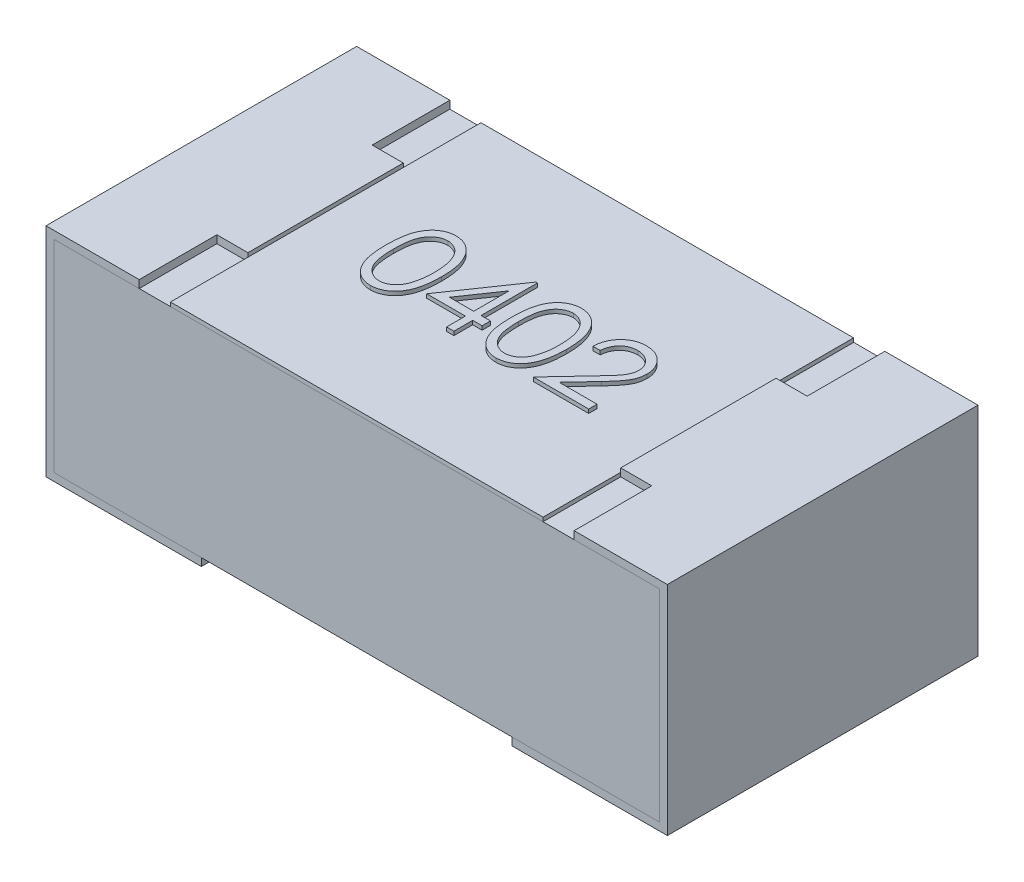
from build123d import *

# Parameters (mm, degrees)
CROQUIS1_W              = 1
CROQUIS1_H              = 0.5
SALIENTE_EXTRUIR1_DEPTH = 0.35
CROQUIS2_W              = 0.5
CROQUIS2_H              = 0.0125
CROQUIS2_W_2            = 0.6
CORTAR_EXTRUIR1_DEPTH   = 1.788986692
CROQUIS3_W              = 0.05
CROQUIS3_H              = 0.125
CORTAR_EXTRUIR3_DEPTH   = 0.0125
CROQUIS4_W              = 0.6
CROQUIS4_H              = 0.5
SALIENTE_EXTRUIR2_DEPTH = 0.00625
SALIENTE_EXTRUIR2_TAPER = 1
SALIENTE_EXTRUIR3_START = 0.34375
SALIENTE_EXTRUIR3_DEPTH = 0.00625


# Read off the part's stored shape, not the designer's step: Saliente-Extruir3
with BuildPart() as part:
    # Croquis1 → Saliente-Extruir1 (new body)
    with BuildSketch(Plane(origin=(0, 0, 0), x_dir=(1, 0, 0), z_dir=(0, 1, 0))):
        Rectangle(CROQUIS1_W, CROQUIS1_H)
    extrude(amount=SALIENTE_EXTRUIR1_DEPTH)

    # Croquis2 → Cortar-Extruir1 (cut, through all)
    with BuildSketch(Plane.XY.offset(0.25)):
        with Locations((0, 0.00625)):
            Rectangle(CROQUIS2_W, CROQUIS2_H)
        with Locations((0, 0.34375)):
            Rectangle(CROQUIS2_W_2, CROQUIS2_H)
    extrude(amount=-CORTAR_EXTRUIR1_DEPTH, mode=Mode.SUBTRACT)

    # Croquis3 → Cortar-Extruir3 (cut)
    with BuildSketch(Plane(origin=(0, 0.35, 0), x_dir=(1, 0, 0), z_dir=(0, 1, 0))):
        with Locations((-0.325, -0.1875)):
            Rectangle(CROQUIS3_W, CROQUIS3_H)
        with Locations((-0.325, 0.1875)):
            Rectangle(CROQUIS3_W, CROQUIS3_H)
        with Locations((0.325, 0.1875)):
            Rectangle(CROQUIS3_W, CROQUIS3_H)
        with Locations((0.325, -0.1875)):
            Rectangle(CROQUIS3_W, CROQUIS3_H)
    extrude(amount=-CORTAR_EXTRUIR3_DEPTH, mode=Mode.SUBTRACT)

    # Croquis4 → Saliente-Extruir2 (add)
    with BuildSketch(Plane(origin=(0, 0.3375, 0), x_dir=(1, 0, 0), z_dir=(0, 1, 0))):
        Rectangle(CROQUIS4_W, CROQUIS4_H)
    extrude(amount=SALIENTE_EXTRUIR2_DEPTH, taper=SALIENTE_EXTRUIR2_TAPER)

    # Saliente-Extruir3 outline → Saliente-Extruir3 (add)
    # profile 1 of 4: a face of its own
    with BuildSketch(Plane(origin=(0, 0, 0), x_dir=(1, 0, 0), z_dir=(0, 1, 0)).offset(SALIENTE_EXTRUIR3_START)):
        with BuildLine():
            add(Edge.make_bspline(
                [(-0.155899178, -0.072053334), (-0.156933758, -0.072035856), (-0.158973746, -0.072001391), (-0.161996532, -0.071644825), (-0.164930494, -0.071071562), (-0.167790108, -0.070268885), (-0.170590046, -0.069286375), (-0.173292155, -0.068006323), (-0.17592648, -0.066532115), (-0.178485991, -0.064853219), (-0.180922593, -0.062929725), (-0.183249997, -0.060802246), (-0.185409735, -0.058417694), (-0.187419897, -0.055813718), (-0.189330363, -0.053014278), (-0.191087738, -0.049981149), (-0.192713242, -0.04672636), (-0.194199047, -0.043228882), (-0.19551639, -0.039437679), (-0.196680032, -0.035309379), (-0.197598803, -0.030807544), (-0.198385227, -0.025968332), (-0.199019538, -0.020770948), (-0.199452585, -0.01521257), (-0.199720236, -0.009296662), (-0.199744037, -0.0052388), (-0.199756267, -0.003153821)],
                knots=[0, 0, 0, 0, 0.033787146, 0.066621658, 0.099284878, 0.131361165, 0.163585188, 0.196103927, 0.228902254, 0.262158056, 0.295991222, 0.330217846, 0.365059826, 0.400950737, 0.437620382, 0.475707529, 0.515380692, 0.556413541, 0.59976483, 0.646424156, 0.696431445, 0.749781518, 0.806573307, 0.867435532, 0.931886753, 1, 1, 1, 1], degree=3))
            add(Edge.make_bspline(
                [(-0.110623106, -0.003153821), (-0.110647527, -0.005159853), (-0.11069511, -0.009068524), (-0.110941674, -0.014785259), (-0.111427353, -0.020182187), (-0.11203489, -0.02527225), (-0.112876334, -0.030034265), (-0.113910953, -0.034484709), (-0.115059701, -0.038642801), (-0.116477718, -0.042474477), (-0.118029757, -0.046033189), (-0.119718389, -0.04935636), (-0.121527502, -0.052473364), (-0.123498485, -0.055359251), (-0.12559932, -0.058034464), (-0.127874973, -0.060451781), (-0.130261293, -0.062669449), (-0.132787855, -0.064642789), (-0.135426822, -0.066370009), (-0.138123788, -0.06791467), (-0.140926608, -0.069160204), (-0.143771762, -0.070229674), (-0.146699949, -0.071046737), (-0.149707517, -0.071611692), (-0.152779169, -0.072007916), (-0.154855574, -0.072038143), (-0.155899178, -0.072053334)],
                knots=[0, 0, 0, 0, 0.06506329, 0.126773166, 0.185515763, 0.240764679, 0.292979796, 0.342250373, 0.388919286, 0.432775664, 0.474628433, 0.514774691, 0.553605893, 0.591426406, 0.62802812, 0.663803634, 0.698984336, 0.733591489, 0.767628469, 0.801208348, 0.83426384, 0.866980695, 0.899719742, 0.932701912, 0.966175883, 1, 1, 1, 1], degree=3))
            add(Edge.make_bspline(
                [(-0.155899178, 0.065850802), (-0.154855927, 0.065832519), (-0.15278123, 0.06579616), (-0.14971392, 0.065446706), (-0.146717473, 0.064866861), (-0.143804661, 0.064045281), (-0.140951559, 0.06302601), (-0.138180484, 0.061748453), (-0.135474222, 0.060261322), (-0.132875781, 0.058513897), (-0.130356632, 0.056565645), (-0.127978655, 0.054363268), (-0.125741633, 0.051929007), (-0.123617489, 0.049288904), (-0.121666488, 0.046392323), (-0.119808517, 0.043289643), (-0.11814549, 0.039926604), (-0.11654383, 0.036359319), (-0.115161336, 0.032489083), (-0.113914544, 0.028337711), (-0.112907143, 0.023856169), (-0.112068012, 0.019067971), (-0.111417939, 0.013955531), (-0.110944478, 0.00852981), (-0.110694376, 0.002787236), (-0.110647276, -0.001139002), (-0.110623106, -0.003153821)],
                knots=[0, 0, 0, 0, 0.033788116, 0.067193932, 0.099862411, 0.132566612, 0.165151173, 0.197913187, 0.231319004, 0.265083278, 0.299255309, 0.334398567, 0.369942824, 0.406283561, 0.44406382, 0.482997707, 0.523354447, 0.56553659, 0.609612924, 0.656390811, 0.705885495, 0.7583245, 0.813831783, 0.872794559, 0.93472223, 1, 1, 1, 1], degree=3))
            add(Edge.make_bspline(
                [(-0.199756267, -0.003153821), (-0.199743973, -0.001051338), (-0.199720092, 0.003032767), (-0.199454424, 0.008983884), (-0.199013094, 0.014566793), (-0.198408279, 0.01978176), (-0.197672263, 0.024630132), (-0.196689729, 0.029098952), (-0.19557237, 0.033208903), (-0.194277372, 0.036973388), (-0.192816142, 0.040443124), (-0.191225741, 0.043682269), (-0.189443052, 0.046685922), (-0.187569959, 0.049502024), (-0.185530639, 0.052084478), (-0.183383128, 0.054469752), (-0.181043608, 0.05660272), (-0.178591608, 0.058545877), (-0.176004928, 0.060249285), (-0.173357299, 0.061749679), (-0.170630498, 0.063031462), (-0.167817079, 0.064039293), (-0.164942331, 0.064871737), (-0.161996203, 0.065441007), (-0.158973831, 0.065799192), (-0.156933786, 0.065833435), (-0.155899178, 0.065850802)],
                knots=[0, 0, 0, 0, 0.068594622, 0.133246042, 0.194312586, 0.251279223, 0.304513439, 0.354234907, 0.400480589, 0.443410755, 0.484014869, 0.523252301, 0.561042373, 0.597900239, 0.633518489, 0.668314351, 0.702495671, 0.736685354, 0.770293169, 0.803437255, 0.835912952, 0.868460246, 0.900846538, 0.933466525, 0.966257575, 1, 1, 1, 1], degree=3))
        make_face()
        with BuildLine():
            add(Edge.make_bspline(
                [(-0.155505016, 0.05239674), (-0.156955857, 0.052320603), (-0.159860182, 0.05216819), (-0.164149597, 0.051092791), (-0.168261225, 0.049218346), (-0.17153102, 0.047158777), (-0.174037019, 0.04519718), (-0.17580164, 0.043496133), (-0.177456202, 0.041635433), (-0.178980393, 0.039596494), (-0.180407948, 0.03740526), (-0.181719008, 0.035044494), (-0.182900251, 0.03250223), (-0.183990315, 0.029780626), (-0.184948762, 0.026797998), (-0.185739347, 0.023508489), (-0.186469705, 0.019893177), (-0.186986741, 0.015930897), (-0.187446376, 0.011647697), (-0.187741762, 0.007027365), (-0.187971557, 0.002077701), (-0.187979745, -0.001340368), (-0.187983963, -0.003101266)],
                knots=[0, 0, 0, 0, 0.060386619, 0.120883249, 0.182754619, 0.24781103, 0.2812991, 0.315087624, 0.349702396, 0.384856581, 0.420966197, 0.458511188, 0.497174722, 0.537602048, 0.580503018, 0.62746754, 0.67838821, 0.733983221, 0.793746705, 0.857713672, 0.926697864, 1, 1, 1, 1], degree=3))
            add(Edge.make_bspline(
                [(-0.12239541, -0.003101266), (-0.122416031, -0.001524609), (-0.122456369, 0.001559671), (-0.122610558, 0.006076593), (-0.123008721, 0.01036675), (-0.123450942, 0.014448624), (-0.124102976, 0.018299621), (-0.124806003, 0.021951978), (-0.125750523, 0.025360447), (-0.126759454, 0.028578393), (-0.127914202, 0.031569256), (-0.129185336, 0.034346979), (-0.130542898, 0.036924974), (-0.132017412, 0.039296166), (-0.133591376, 0.041471178), (-0.135306331, 0.0434064), (-0.137094251, 0.045161811), (-0.139598504, 0.047165543), (-0.142876968, 0.049208597), (-0.146956413, 0.051088768), (-0.151201703, 0.052168479), (-0.154071613, 0.052320708), (-0.155505016, 0.05239674)],
                knots=[0, 0, 0, 0, 0.065681198, 0.128486464, 0.18817513, 0.245106131, 0.299448425, 0.350822936, 0.399941681, 0.446671744, 0.491254533, 0.533376344, 0.573852755, 0.612526312, 0.649597136, 0.685532042, 0.720105786, 0.753837663, 0.818925416, 0.880493462, 0.940311334, 1, 1, 1, 1], degree=3))
            add(Edge.make_bspline(
                [(-0.127361851, -0.036079485), (-0.12696638, -0.03490902), (-0.126163403, -0.032532475), (-0.125128536, -0.028845886), (-0.124313537, -0.024977932), (-0.123580318, -0.020951727), (-0.123079857, -0.01673758), (-0.122677037, -0.01234853), (-0.122439769, -0.007781267), (-0.122410357, -0.004678179), (-0.12239541, -0.003101266)],
                knots=[0, 0, 0, 0, 0.110588339, 0.224541754, 0.342503494, 0.464324098, 0.590756033, 0.722227475, 0.858842836, 1, 1, 1, 1], degree=3))
            add(Edge.make_bspline(
                [(-0.155505016, -0.058599272), (-0.154052411, -0.058539389), (-0.151150199, -0.058419745), (-0.146910038, -0.057265434), (-0.14279369, -0.055523794), (-0.139567785, -0.053464407), (-0.137113553, -0.051503185), (-0.135355143, -0.049831065), (-0.133741213, -0.04795876), (-0.132210486, -0.045938659), (-0.130806551, -0.043732167), (-0.129529893, -0.041349894), (-0.128364915, -0.038785225), (-0.127701194, -0.036994855), (-0.127361851, -0.036079485)],
                knots=[0, 0, 0, 0, 0.112813401, 0.225393884, 0.339594815, 0.45967541, 0.52173519, 0.583925839, 0.648174145, 0.713881038, 0.781004455, 0.851450928, 0.924050693, 1, 1, 1, 1], degree=3))
            add(Edge.make_bspline(
                [(-0.187983963, -0.003101266), (-0.187979486, -0.004853369), (-0.187970798, -0.008253856), (-0.187743816, -0.013195232), (-0.187434604, -0.017804059), (-0.187035777, -0.022086187), (-0.186443496, -0.026027122), (-0.18577986, -0.02965397), (-0.184972255, -0.032947536), (-0.184016723, -0.035930421), (-0.182928362, -0.038653248), (-0.181740052, -0.041186886), (-0.180463485, -0.043561264), (-0.17903481, -0.045755055), (-0.17747886, -0.047775414), (-0.175830779, -0.049658099), (-0.174029058, -0.051337052), (-0.171536553, -0.053350691), (-0.168246014, -0.055431502), (-0.164100051, -0.057243473), (-0.159839851, -0.058382183), (-0.156948286, -0.058526993), (-0.155505016, -0.058599272)],
                knots=[0, 0, 0, 0, 0.072951066, 0.141583694, 0.20592646, 0.265301357, 0.320597233, 0.371816503, 0.41878977, 0.461698729, 0.502133582, 0.540804315, 0.578180525, 0.614296865, 0.649678243, 0.68429946, 0.718358953, 0.752080865, 0.817652439, 0.879722076, 0.93996556, 1, 1, 1, 1], degree=3))
        make_face(mode=Mode.SUBTRACT)
    # profile 2 of 4: a face of its own
    with BuildSketch(Plane(origin=(0, 0, 0), x_dir=(1, 0, 0), z_dir=(0, 1, 0)).offset(SALIENTE_EXTRUIR3_START)):
        with BuildLine():
            add(Edge.make_bspline(
                [(0.045911753, -0.072053334), (0.044877173, -0.072035856), (0.042837185, -0.072001391), (0.039814398, -0.071644825), (0.036880437, -0.071071562), (0.034020823, -0.070268885), (0.031220885, -0.069286375), (0.028518775, -0.068006323), (0.025884451, -0.066532115), (0.02332494, -0.064853219), (0.020888338, -0.062929725), (0.018560934, -0.060802246), (0.016401196, -0.058417694), (0.014391034, -0.055813718), (0.012480568, -0.053014278), (0.010723193, -0.049981149), (0.009097689, -0.04672636), (0.007611884, -0.043228882), (0.006294541, -0.039437679), (0.005130898, -0.035309379), (0.004212128, -0.030807544), (0.003425704, -0.025968332), (0.002791392, -0.020770948), (0.002358346, -0.01521257), (0.002090695, -0.009296662), (0.002066893, -0.0052388), (0.002054664, -0.003153821)],
                knots=[0, 0, 0, 0, 0.033787146, 0.066621658, 0.099284878, 0.131361165, 0.163585188, 0.196103927, 0.228902254, 0.262158056, 0.295991222, 0.330217846, 0.365059826, 0.400950737, 0.437620382, 0.475707529, 0.515380692, 0.556413541, 0.59976483, 0.646424156, 0.696431445, 0.749781518, 0.806573307, 0.867435532, 0.931886753, 1, 1, 1, 1], degree=3))
            add(Edge.make_bspline(
                [(0.091187825, -0.003153821), (0.091163404, -0.005159853), (0.091115821, -0.009068524), (0.090869256, -0.014785259), (0.090383577, -0.020182187), (0.089776041, -0.02527225), (0.088934597, -0.030034265), (0.087899978, -0.034484709), (0.086751229, -0.038642801), (0.085333213, -0.042474477), (0.083781173, -0.046033189), (0.082092542, -0.04935636), (0.080283429, -0.052473364), (0.078312446, -0.055359251), (0.076211611, -0.058034464), (0.073935958, -0.060451781), (0.071549637, -0.062669449), (0.069023076, -0.064642789), (0.066384109, -0.066370009), (0.063687142, -0.06791467), (0.060884323, -0.069160204), (0.058039168, -0.070229674), (0.055110982, -0.071046737), (0.052103413, -0.071611692), (0.049031761, -0.072007916), (0.046955357, -0.072038143), (0.045911753, -0.072053334)],
                knots=[0, 0, 0, 0, 0.06506329, 0.126773166, 0.185515763, 0.240764679, 0.292979796, 0.342250373, 0.388919286, 0.432775664, 0.474628433, 0.514774691, 0.553605893, 0.591426406, 0.62802812, 0.663803634, 0.698984336, 0.733591489, 0.767628469, 0.801208348, 0.83426384, 0.866980695, 0.899719742, 0.932701912, 0.966175883, 1, 1, 1, 1], degree=3))
            add(Edge.make_bspline(
                [(0.045911753, 0.065850802), (0.046955003, 0.065832519), (0.049029701, 0.06579616), (0.05209701, 0.065446706), (0.055093458, 0.064866861), (0.05800627, 0.064045281), (0.060859371, 0.06302601), (0.063630447, 0.061748453), (0.066336708, 0.060261322), (0.06893515, 0.058513897), (0.071454298, 0.056565645), (0.073832276, 0.054363268), (0.076069298, 0.051929007), (0.078193442, 0.049288904), (0.080144442, 0.046392323), (0.082002414, 0.043289643), (0.083665441, 0.039926604), (0.085267101, 0.036359319), (0.086649595, 0.032489083), (0.087896386, 0.028337711), (0.088903788, 0.023856169), (0.089742919, 0.019067971), (0.090392992, 0.013955531), (0.090866453, 0.00852981), (0.091116554, 0.002787236), (0.091163654, -0.001139002), (0.091187825, -0.003153821)],
                knots=[0, 0, 0, 0, 0.033788116, 0.067193932, 0.099862411, 0.132566612, 0.165151173, 0.197913187, 0.231319004, 0.265083278, 0.299255309, 0.334398567, 0.369942824, 0.406283561, 0.44406382, 0.482997707, 0.523354447, 0.56553659, 0.609612924, 0.656390811, 0.705885495, 0.7583245, 0.813831783, 0.872794559, 0.93472223, 1, 1, 1, 1], degree=3))
            add(Edge.make_bspline(
                [(0.002054664, -0.003153821), (0.002066957, -0.001051338), (0.002090838, 0.003032767), (0.002356507, 0.008983884), (0.002797837, 0.014566793), (0.003402652, 0.01978176), (0.004138667, 0.024630132), (0.005121202, 0.029098952), (0.006238561, 0.033208903), (0.007533558, 0.036973388), (0.008994788, 0.040443124), (0.010585189, 0.043682269), (0.012367879, 0.046685922), (0.014240972, 0.049502024), (0.016280291, 0.052084478), (0.018427803, 0.054469752), (0.020767323, 0.05660272), (0.023219323, 0.058545877), (0.025806003, 0.060249285), (0.028453632, 0.061749679), (0.031180433, 0.063031462), (0.033993851, 0.064039293), (0.0368686, 0.064871737), (0.039814728, 0.065441007), (0.042837099, 0.065799192), (0.044877144, 0.065833435), (0.045911753, 0.065850802)],
                knots=[0, 0, 0, 0, 0.068594622, 0.133246042, 0.194312586, 0.251279223, 0.304513439, 0.354234907, 0.400480589, 0.443410755, 0.484014869, 0.523252301, 0.561042373, 0.597900239, 0.633518489, 0.668314351, 0.702495671, 0.736685354, 0.770293169, 0.803437255, 0.835912952, 0.868460246, 0.900846538, 0.933466525, 0.966257575, 1, 1, 1, 1], degree=3))
        make_face()
        with BuildLine():
            add(Edge.make_bspline(
                [(0.046305915, 0.05239674), (0.044855074, 0.052320603), (0.041950749, 0.05216819), (0.037661334, 0.051092791), (0.033549705, 0.049218346), (0.030279911, 0.047158777), (0.027773912, 0.04519718), (0.026009291, 0.043496133), (0.024354729, 0.041635433), (0.022830537, 0.039596494), (0.021402983, 0.03740526), (0.020091923, 0.035044494), (0.01891068, 0.03250223), (0.017820615, 0.029780626), (0.016862168, 0.026797998), (0.016071584, 0.023508489), (0.015341225, 0.019893177), (0.01482419, 0.015930897), (0.014364555, 0.011647697), (0.014069168, 0.007027365), (0.013839374, 0.002077701), (0.013831186, -0.001340368), (0.013826968, -0.003101266)],
                knots=[0, 0, 0, 0, 0.060386619, 0.120883249, 0.182754619, 0.24781103, 0.2812991, 0.315087624, 0.349702396, 0.384856581, 0.420966197, 0.458511188, 0.497174722, 0.537602048, 0.580503018, 0.62746754, 0.67838821, 0.733983221, 0.793746705, 0.857713672, 0.926697864, 1, 1, 1, 1], degree=3))
            add(Edge.make_bspline(
                [(0.07941552, -0.003101266), (0.0793949, -0.001524609), (0.079354561, 0.001559671), (0.079200372, 0.006076593), (0.07880221, 0.01036675), (0.078359988, 0.014448624), (0.077707955, 0.018299621), (0.077004928, 0.021951978), (0.076060407, 0.025360447), (0.075051476, 0.028578393), (0.073896728, 0.031569256), (0.072625595, 0.034346979), (0.071268033, 0.036924974), (0.069793518, 0.039296166), (0.068219555, 0.041471178), (0.0665046, 0.0434064), (0.064716679, 0.045161811), (0.062212427, 0.047165543), (0.058933963, 0.049208597), (0.054854518, 0.051088768), (0.050609228, 0.052168479), (0.047739318, 0.052320708), (0.046305915, 0.05239674)],
                knots=[0, 0, 0, 0, 0.065681198, 0.128486464, 0.18817513, 0.245106131, 0.299448425, 0.350822936, 0.399941681, 0.446671744, 0.491254533, 0.533376344, 0.573852755, 0.612526312, 0.649597136, 0.685532042, 0.720105786, 0.753837663, 0.818925416, 0.880493462, 0.940311334, 1, 1, 1, 1], degree=3))
            add(Edge.make_bspline(
                [(0.074449079, -0.036079485), (0.074844551, -0.03490902), (0.075647528, -0.032532475), (0.076682394, -0.028845886), (0.077497394, -0.024977932), (0.078230613, -0.020951727), (0.078731074, -0.01673758), (0.079133893, -0.01234853), (0.079371162, -0.007781267), (0.079400574, -0.004678179), (0.07941552, -0.003101266)],
                knots=[0, 0, 0, 0, 0.110588339, 0.224541754, 0.342503494, 0.464324098, 0.590756033, 0.722227475, 0.858842836, 1, 1, 1, 1], degree=3))
            add(Edge.make_bspline(
                [(0.046305915, -0.058599272), (0.04775852, -0.058539389), (0.050660732, -0.058419745), (0.054900893, -0.057265434), (0.059017241, -0.055523794), (0.062243146, -0.053464407), (0.064697377, -0.051503185), (0.066455787, -0.049831065), (0.068069717, -0.04795876), (0.069600444, -0.045938659), (0.07100438, -0.043732167), (0.072281038, -0.041349894), (0.073446016, -0.038785225), (0.074109736, -0.036994855), (0.074449079, -0.036079485)],
                knots=[0, 0, 0, 0, 0.112813401, 0.225393884, 0.339594815, 0.45967541, 0.52173519, 0.583925839, 0.648174145, 0.713881038, 0.781004455, 0.851450928, 0.924050693, 1, 1, 1, 1], degree=3))
            add(Edge.make_bspline(
                [(0.013826968, -0.003101266), (0.013831445, -0.004853369), (0.013840133, -0.008253856), (0.014067115, -0.013195232), (0.014376326, -0.017804059), (0.014775153, -0.022086187), (0.015367435, -0.026027122), (0.016031071, -0.02965397), (0.016838675, -0.032947536), (0.017794207, -0.035930421), (0.018882569, -0.038653248), (0.020070878, -0.041186886), (0.021347446, -0.043561264), (0.02277612, -0.045755055), (0.02433207, -0.047775414), (0.025980152, -0.049658099), (0.027781873, -0.051337052), (0.030274378, -0.053350691), (0.033564917, -0.055431502), (0.03771088, -0.057243473), (0.04197108, -0.058382183), (0.044862645, -0.058526993), (0.046305915, -0.058599272)],
                knots=[0, 0, 0, 0, 0.072951066, 0.141583694, 0.20592646, 0.265301357, 0.320597233, 0.371816503, 0.41878977, 0.461698729, 0.502133582, 0.540804315, 0.578180525, 0.614296865, 0.649678243, 0.68429946, 0.718358953, 0.752080865, 0.817652439, 0.879722076, 0.93996556, 1, 1, 1, 1], degree=3))
        make_face(mode=Mode.SUBTRACT)
    # profile 3 of 4: a face of its own
    with BuildSketch(Plane(origin=(0, 0, 0), x_dir=(1, 0, 0), z_dir=(0, 1, 0)).offset(SALIENTE_EXTRUIR3_START)):
        with BuildLine():
            add(Edge.make_bspline(
                [(0.150180733, 0.05239674), (0.149154897, 0.052369941), (0.147140324, 0.052317312), (0.144182504, 0.051949167), (0.141360856, 0.051314051), (0.138668281, 0.050445408), (0.136100223, 0.049341326), (0.133669172, 0.04796615), (0.131380586, 0.046325181), (0.129230161, 0.044464694), (0.127248863, 0.04239331), (0.125508072, 0.04008422), (0.123987017, 0.037579583), (0.122659908, 0.034886159), (0.121582169, 0.031979508), (0.120758633, 0.028869947), (0.120106989, 0.025570978), (0.11988929, 0.023292804), (0.119777706, 0.0221251)],
                knots=[0, 0, 0, 0, 0.064438672, 0.126546911, 0.186887153, 0.245877536, 0.304040885, 0.362191218, 0.420975933, 0.480660283, 0.540600275, 0.600689098, 0.66193579, 0.724442506, 0.789038394, 0.856313757, 0.926352028, 1, 1, 1, 1], degree=3))
            add(Edge.make_bspline(
                [(0.178639228, 0.025803945), (0.178615401, 0.026699), (0.178568442, 0.028462982), (0.178154009, 0.031049261), (0.177527713, 0.033544055), (0.176630264, 0.035955038), (0.17544567, 0.03825797), (0.17400372, 0.040455655), (0.172340017, 0.04258031), (0.170415414, 0.044572452), (0.168301156, 0.046396983), (0.166067613, 0.048013238), (0.163704548, 0.049363954), (0.161221923, 0.05047122), (0.15862666, 0.051339814), (0.155913739, 0.051941676), (0.153090657, 0.05231956), (0.151162973, 0.052370688), (0.150180733, 0.05239674)],
                knots=[0, 0, 0, 0, 0.061965401, 0.122121906, 0.180988497, 0.239933216, 0.299905831, 0.359988847, 0.421775742, 0.486575826, 0.551534805, 0.615017543, 0.677258617, 0.739729962, 0.803050103, 0.866495132, 0.931973474, 1, 1, 1, 1], degree=3))
            add(Edge.make_bspline(
                [(0.153833301, -0.014400576), (0.155071908, -0.013107608), (0.15745102, -0.010624081), (0.160815997, -0.006998235), (0.163838279, -0.003634497), (0.166537432, -0.000539221), (0.1688549, 0.002332867), (0.170911466, 0.004888748), (0.17255926, 0.007240733), (0.174347594, 0.009966991), (0.176079655, 0.013295603), (0.177568042, 0.017363356), (0.178475594, 0.021550801), (0.178584465, 0.024380555), (0.178639228, 0.025803945)],
                knots=[0, 0, 0, 0, 0.110802644, 0.212829202, 0.30610131, 0.390647321, 0.466924469, 0.534481039, 0.593586941, 0.644557005, 0.736200453, 0.825024026, 0.911985585, 1, 1, 1, 1], degree=3))
            Line((0.153833301, -0.014400576), (0.102960129, -0.068689819))
            Line((0.102960129, -0.068689819), (0.19209329, -0.068689819))
            Line((0.19209329, -0.068689819), (0.19209329, -0.055235757))
            Line((0.19209329, -0.055235757), (0.131050739, -0.055235757))
            Line((0.131050739, -0.055235757), (0.163871293, -0.020207896))
            add(Edge.make_bspline(
                [(0.190411532, 0.026855044), (0.19034807, 0.025028015), (0.19022226, 0.02140602), (0.189146069, 0.01608342), (0.187465258, 0.010926533), (0.185441482, 0.00677619), (0.1833999, 0.003431793), (0.181560141, 0.000678246), (0.179406407, -0.002286561), (0.176907352, -0.005452702), (0.174114671, -0.008844976), (0.171003069, -0.012461333), (0.167550358, -0.016264411), (0.16512701, -0.018861928), (0.163871293, -0.020207896)],
                knots=[0, 0, 0, 0, 0.098702196, 0.195672309, 0.292422427, 0.391342544, 0.444462441, 0.504228775, 0.570352338, 0.642545753, 0.722287505, 0.807921123, 0.900469538, 1, 1, 1, 1], degree=3))
            add(Edge.make_bspline(
                [(0.150785115, 0.065850802), (0.152223494, 0.065817128), (0.155049856, 0.065750961), (0.159174889, 0.065182738), (0.163101855, 0.064292773), (0.166823079, 0.063044139), (0.170308869, 0.061365656), (0.173585413, 0.059349368), (0.176691717, 0.057017421), (0.179487917, 0.054271928), (0.182055544, 0.051340968), (0.184270647, 0.04821191), (0.186167587, 0.044980108), (0.187748746, 0.041620917), (0.188912704, 0.038102708), (0.189796396, 0.034476703), (0.190295897, 0.030705369), (0.190372557, 0.028152791), (0.190411532, 0.026855044)],
                knots=[0, 0, 0, 0, 0.06947546, 0.136516798, 0.200788824, 0.263829673, 0.325735023, 0.387290692, 0.449509219, 0.51296782, 0.576275215, 0.6375801, 0.697902606, 0.757172088, 0.816598528, 0.876653171, 0.937289642, 1, 1, 1, 1], degree=3))
            add(Edge.make_bspline(
                [(0.108005402, 0.0221251), (0.108082128, 0.02368689), (0.108232815, 0.026754205), (0.108938484, 0.031226367), (0.109948205, 0.035501046), (0.111375842, 0.039543921), (0.113148842, 0.043390739), (0.115275036, 0.047026219), (0.117793406, 0.050436494), (0.120649571, 0.053589948), (0.123751672, 0.056482874), (0.127098784, 0.058981058), (0.130616018, 0.061091797), (0.134292703, 0.062856363), (0.138170319, 0.064180871), (0.142213679, 0.065163637), (0.146440548, 0.065754921), (0.149320448, 0.065818478), (0.150785115, 0.065850802)],
                knots=[0, 0, 0, 0, 0.068790794, 0.135103289, 0.198978674, 0.2619043, 0.323494969, 0.385195378, 0.446969239, 0.509764777, 0.572250569, 0.633405176, 0.693251163, 0.752583163, 0.812579266, 0.873275085, 0.935549943, 1, 1, 1, 1], degree=3))
            Line((0.108005402, 0.0221251), (0.119777706, 0.0221251))
        make_face()
    # profile 4 of 4: a face of its own
    with BuildSketch(Plane(origin=(0, 0, 0), x_dir=(1, 0, 0), z_dir=(0, 1, 0)).offset(SALIENTE_EXTRUIR3_START)):
        Polygon((-0.024853461, 0.065850802), (-0.02724471, 0.065850802), (-0.098850802, -0.038418179), (-0.036625765, -0.038418179), (-0.036625765, -0.068689819), (-0.024853461, -0.068689819), (-0.024853461, -0.038418179), (-0.009717641, -0.038418179), (-0.009717641, -0.024964117), (-0.024853461, -0.024964117), align=None)
        Polygon((-0.075726633, -0.024964117), (-0.036625765, 0.032005427), (-0.036625765, -0.024964117), align=None, mode=Mode.SUBTRACT)
    extrude(amount=SALIENTE_EXTRUIR3_DEPTH)


solid = part.part
